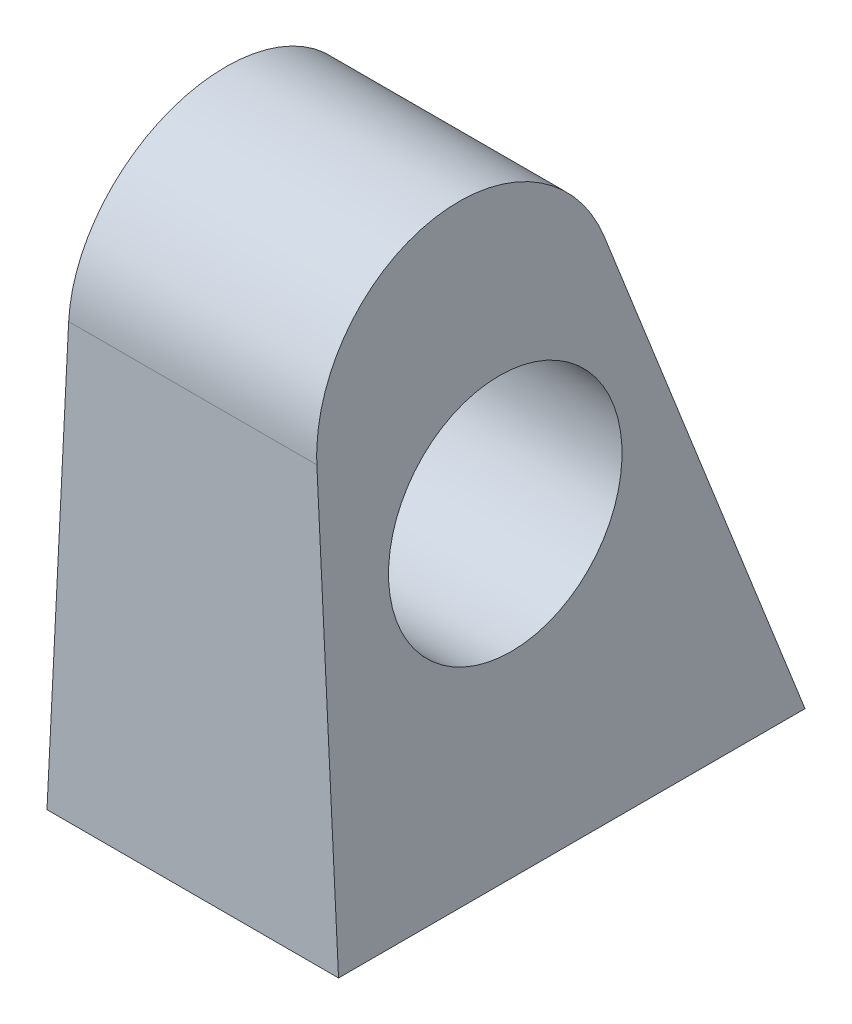
from build123d import *

# Parameters (mm, degrees)
SKETCH1_R           = 3.175
BOSS_EXTRUDE1_DEPTH = 7.9375
SKETCH2_OUTSIDE_W   = 14.302
SKETCH2_OUTSIDE_H   = 22.239
CUT_EXTRUDE1_DEPTH  = 22.824516747


with BuildPart() as part:
    # Sketch1 → Boss-Extrude1 (new body)
    with BuildSketch(Plane(origin=(0, 0, 0), x_dir=(0, 0, -1), z_dir=(1, 0, 0))):
        with BuildLine():
            Line((1.546976538, 13.196198506), (6.35, 0))
            Line((6.35, 0), (-6.35, 0))
            Line((-6.35, 0), (-6.35, 11.803748476))
            ThreePointArc((-6.35, 11.803748476), (-2.985713884, 15.813148541), (1.546976538, 13.196198506))
        make_face()
        with Locations((-1.397493364, 8.266095407)):
            Circle(SKETCH1_R, mode=Mode.SUBTRACT)
    extrude(amount=BOSS_EXTRUDE1_DEPTH)

    # Sketch2 outside → Cut-Extrude1 (cut, through all)
    with BuildSketch(Plane.XY.offset(6.35)):
        with Locations((3.969, 7.9375)):
            Rectangle(SKETCH2_OUTSIDE_W, SKETCH2_OUTSIDE_H)
        Polygon((0, 0), (7.9375, 0), (7.14375, 15.875), (0.79375, 15.875), align=None, mode=Mode.SUBTRACT)
    extrude(amount=-CUT_EXTRUDE1_DEPTH, mode=Mode.SUBTRACT)


solid = part.part
